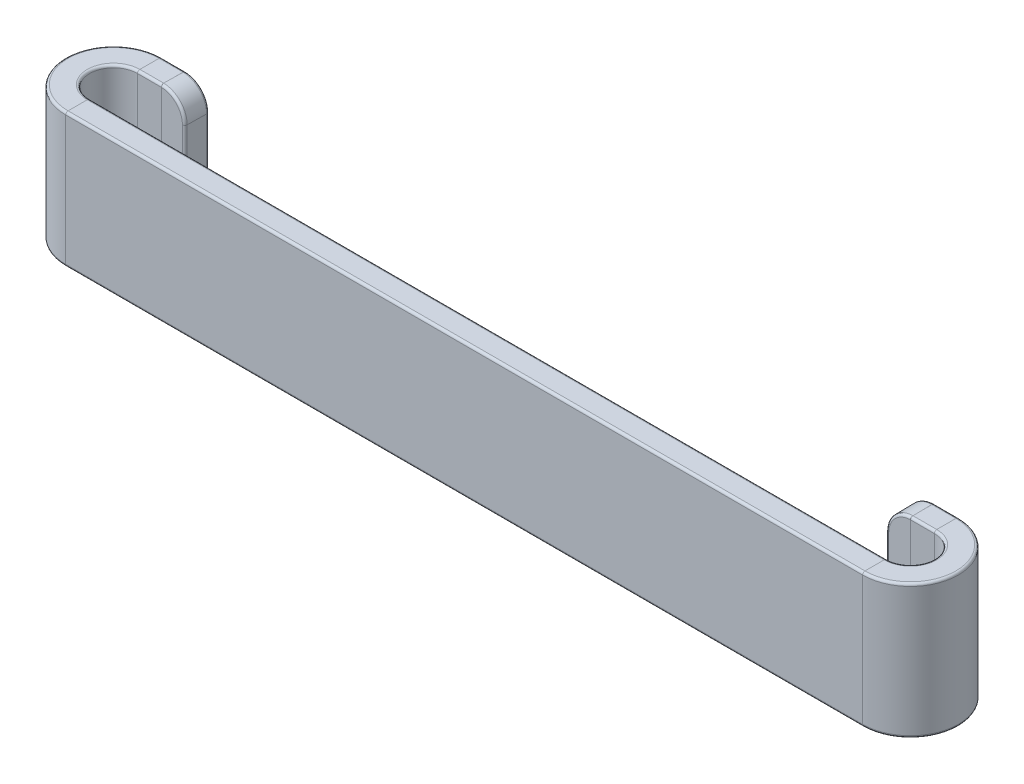
from build123d import *

# Parameters (mm, degrees)
SKETCH1_W          = 373
SKETCH1_H          = 56
BASE_FLANGE1_DEPTH = 10
HEM1_START         = -28
HEM1_DEPTH         = 56
HEM1_2_DEPTH       = 56
EDGE_FLANGE2_DEPTH = 56
FILLET4_R          = 10
FILLET5_R          = 1


# Read off the part's stored shape, not the designer's step: Hem1
# Sheet-metal steps are written as plain solids
with BuildPart() as part:
    # Sketch1 → Base-Flange1 (new body)
    with BuildSketch(Plane.XY):
        Rectangle(SKETCH1_W, SKETCH1_H)
    extrude(amount=-BASE_FLANGE1_DEPTH)

    # Hem1 outline → Hem1 (cut)
    with BuildSketch(Plane(origin=(0, 0, 0), x_dir=(1, 0, 0), z_dir=(0, 1, 0)).offset(HEM1_START)):
        with BuildLine():
            ThreePointArc((-166.5, 0), (-176.5, 2.679491924), (-183.820508076, 10))
            Line((-183.820508076, 10), (-186.5, 10))
            Line((-186.5, 10), (-186.5, 0))
            Line((-186.5, 0), (-166.5, 0))
        make_face()
    hem1 = extrude(amount=HEM1_DEPTH, mode=Mode.SUBTRACT)

    # Hem1 2 outline → Hem1 2 (add)
    with BuildSketch(Plane(origin=(0, 0, 0), x_dir=(1, 0, 0), z_dir=(0, 1, 0)).offset(HEM1_START)):
        with BuildLine():
            Line((-156.5, 30), (-156.5, 40))
            Line((-156.5, 40), (-166.5, 40))
            ThreePointArc((-166.5, 40), (-183.820508076, 30), (-183.820508076, 10))
            Line((-183.820508076, 10), (-166.5, 10))
            ThreePointArc((-166.5, 10), (-176.5, 20), (-166.5, 30))
            Line((-166.5, 30), (-156.5, 30))
        make_face()
    hem1_2 = extrude(amount=HEM1_2_DEPTH)

    # Mirror1: Hem1, Hem1 2 across plane
    add(hem1.mirror(Plane(origin=(0, 0, 0), x_dir=(0, 0, 1), z_dir=(1, 0, 0))), mode=Mode.SUBTRACT)
    add(hem1_2.mirror(Plane(origin=(0, 0, 0), x_dir=(0, 0, 1), z_dir=(1, 0, 0))))

    # Edge-Flange2 section (across the edge) → Edge-Flange2 (add)
    with BuildSketch(Plane(origin=(-156.493571789, -28, -30), x_dir=(-0.017452406437276777, 0, 0.9998476951563914), z_dir=(0, 1, 0))):
        with BuildLine():
            Line((-10, 0.006428211), (-10, 9.912731322))
            Line((-10, 9.912731322), (0, 9.912731322))
            Line((0, 9.912731322), (0, 0.006428211))
            ThreePointArc((0, 0.006428211), (2.8047e-05, 2.45e-07), (0.000112188, -0.006427232))
            Line((0.000112188, -0.006427232), (-9.998364764, -0.180951296))
            ThreePointArc((-9.998364764, -0.180951296), (-9.999591183, -0.08726511), (-10, 0.006428211))
        make_face()
    edge_flange2 = extrude(amount=EDGE_FLANGE2_DEPTH)

    # Mirror3: Edge-Flange2 across plane
    add(edge_flange2.mirror(Plane(origin=(0, 0, 0), x_dir=(0, 0, 1), z_dir=(1, 0, 0))))

    # Fillet4
    fillet4_edges = [part.edges().sort_by_distance(p)[0] for p in [
        (-146.495088192, -28, -34.82623746),
        (-146.495088192, 28, -34.82623746),
        (146.495088192, -28, -34.82623746),
        (146.495088192, 28, -34.82623746),
    ]]
    fillet(fillet4_edges, radius=FILLET4_R)

    # Fillet5
    fillet5_edges = [part.edges().sort_by_distance(p)[0] for p in [
        (146.582350224, 0, -29.826998984),
        (146.40782616, 0, -39.825475936),
        (149.477791738, 25.037862996, -29.877539104),
        (149.477791738, -25.037862996, -29.877539104),
        (156.493572016, 27.999619199, -29.999971952),
        (156.493572016, -27.999619199, -29.999971952),
        (161.54042688, -28, -30),
        (156.54042655, 27.999918307, -30),
        (156.54042655, -27.999918307, -30),
        (156.453154677, -28, -39.999897803),
        (156.359463518, 27.999890258, -39.999080184),
        (156.359463518, -27.999890258, -39.999080184),
        (149.303267674, 25.037862996, -39.876016055),
        (149.303267674, -25.037862996, -39.876016055),
        (-161.54042688, 28, -30),
        (-156.54042655, 27.999918307, -30),
        (-156.54042655, -27.999918307, -30),
        (-156.493572016, 27.999619199, -29.999971952),
        (-156.493572016, -27.999619199, -29.999971952),
        (-146.582350224, 0, -29.826998984),
        (-149.477791738, 25.037862996, -29.877539104),
        (-149.477791738, -25.037862996, -29.877539104),
        (-146.40782616, 0, -39.825475936),
        (-149.303267674, 25.037862996, -39.876016055),
        (-149.303267674, -25.037862996, -39.876016055),
        (-156.453154677, 28, -39.999897803),
        (-156.359463518, 27.999890258, -39.999080184),
        (-156.359463518, -27.999890258, -39.999080184),
        (0, -28, 0),
        (0, -28, -10),
        (-161.5, 28, -40),
        (-161.5, -28, -40),
        (-161.54042688, -28, -30),
        (-183.820508076, -28, -30),
        (-183.820508076, 28, -30),
        (-176.5, -28, -20),
        (-176.5, 28, -20),
        (0, 28, 0),
        (0, 28, -10),
        (161.5, -28, -40),
        (161.5, 28, -40),
        (161.54042688, 28, -30),
        (183.820508076, 28, -30),
        (183.820508076, -28, -30),
        (176.5, 28, -20),
        (176.5, -28, -20),
        (-156.453154677, -28, -39.999897803),
        (156.453154677, 28, -39.999897803),
    ]]
    fillet(fillet5_edges, radius=FILLET5_R)


solid = part.part
